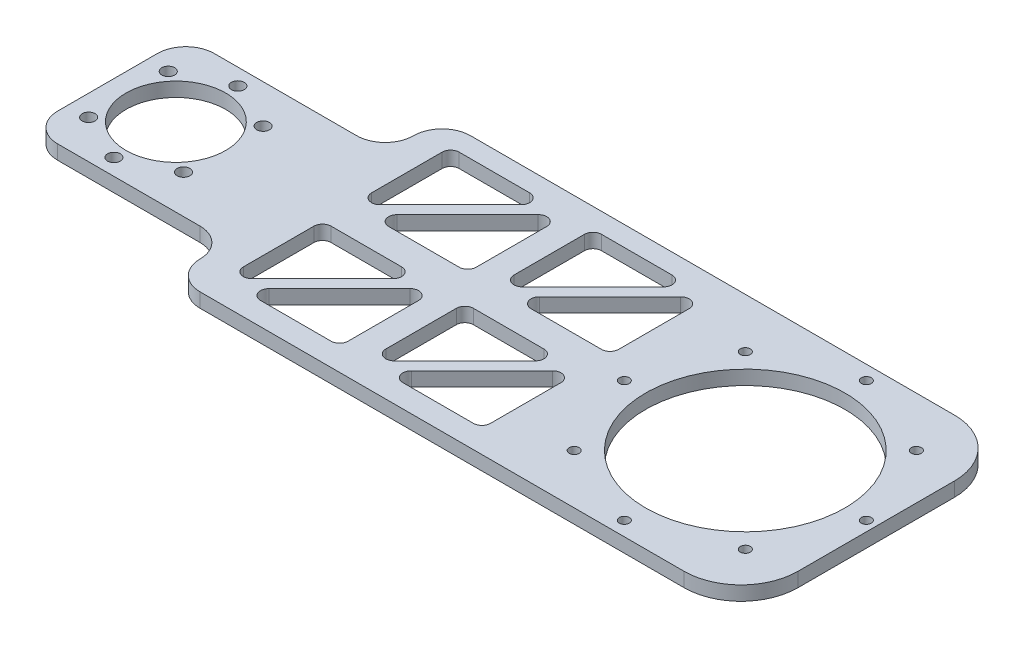
from build123d import *

# Parameters (mm, degrees)
SKETCH_1_W          = 270
SKETCH_1_H          = 5
EXTRUDE_1_DEPTH     = 95
SKETCH_2_R          = 2.25
SKETCH_2_R_2        = 1.75
SKETCH_2_R_3        = 17.5
SKETCH_2_R_4        = 35
CUT_EXTRUDE_1_DEPTH = 10
SKETCH_3_W          = 70
SKETCH_3_H          = 20
CUT_EXTRUDE_2_DEPTH = 10
FILLET_1_R          = 10
FILLET_2_R          = 20


with BuildPart() as part:
    # 草图1 → 拉伸-薄壁1 (new body)
    with BuildSketch(Plane.XY):
        with Locations((-135, -2.5)):
            Rectangle(SKETCH_1_W, SKETCH_1_H)
    extrude(amount=EXTRUDE_1_DEPTH)

    # 草图2 → 切除-拉伸1 (cut)
    with BuildSketch(Plane(origin=(0, 0, 0), x_dir=(1, 0, 0), z_dir=(0, 1, 0))):
        with Locations(Location((-246, -25.75, 0), (0, 0, 270))):
            Circle(SKETCH_2_R)
        with Locations(Location((-229.338533362, -33.519369489, 0), (0, 0, 270))):
            Circle(SKETCH_2_R)
        with Locations(Location((-262.661466638, -33.519369489, 0), (0, 0, 270))):
            Circle(SKETCH_2_R)
        with Locations(Location((-262.661466638, -61.480630511, 0), (0, 0, 270))):
            Circle(SKETCH_2_R)
        with Locations(Location((-246, -69.25, 0), (0, 0, 270))):
            Circle(SKETCH_2_R)
        with Locations(Location((-229.338533362, -61.480630511, 0), (0, 0, 270))):
            Circle(SKETCH_2_R)
        with Locations(Location((-3.5, -47.5, 0), (0, 0, 270))):
            Circle(SKETCH_2_R_2)
        with Locations(Location((-15.9479618, -77.5520382, 0), (0, 0, 270))):
            Circle(SKETCH_2_R_2)
        with Locations(Location((-46, -90, 0), (0, 0, 270))):
            Circle(SKETCH_2_R_2)
        with Locations(Location((-76.0520382, -77.5520382, 0), (0, 0, 270))):
            Circle(SKETCH_2_R_2)
        with Locations(Location((-88.5, -47.5, 0), (0, 0, 270))):
            Circle(SKETCH_2_R_2)
        with Locations(Location((-76.0520382, -17.4479618, 0), (0, 0, 270))):
            Circle(SKETCH_2_R_2)
        with Locations(Location((-46, -5, 0), (0, 0, 270))):
            Circle(SKETCH_2_R_2)
        with Locations(Location((-15.9479618, -17.4479618, 0), (0, 0, 270))):
            Circle(SKETCH_2_R_2)
        with Locations(Location((-246, -47.5, 0), (0, 0, 270))):
            Circle(SKETCH_2_R_3)
        with Locations(Location((-46, -47.5, 0), (0, 0, 270))):
            Circle(SKETCH_2_R_4)
    extrude(amount=-CUT_EXTRUDE_1_DEPTH, mode=Mode.SUBTRACT)

    # 草图3 → 切除-拉伸2 (cut)
    with BuildSketch(Plane(origin=(0, 0, 0), x_dir=(1, 0, 0), z_dir=(0, 1, 0))):
        with Locations((-235, -85)):
            Rectangle(SKETCH_3_W, SKETCH_3_H)
        with Locations((-235, -10)):
            Rectangle(SKETCH_3_W, SKETCH_3_H)
        with BuildLine():
            Line((-190, -10), (-190, -34.757359313))
            ThreePointArc((-190, -34.757359313), (-188.148050297, -37.52899791), (-184.878679656, -36.878679656))
            Line((-184.878679656, -36.878679656), (-160.121320344, -12.121320344))
            ThreePointArc((-160.121320344, -12.121320344), (-159.47100209, -8.851949703), (-162.242640687, -7))
            Line((-162.242640687, -7), (-187, -7))
            ThreePointArc((-187, -7), (-189.121320344, -7.878679656), (-190, -10))
        make_face()
        with BuildLine():
            Line((-154.121320344, -12.121320344), (-178.878679656, -36.878679656))
            ThreePointArc((-178.878679656, -36.878679656), (-179.52899791, -40.148050297), (-176.757359313, -42))
            Line((-176.757359313, -42), (-152, -42))
            ThreePointArc((-152, -42), (-149.878679656, -41.121320344), (-149, -39))
            Line((-149, -39), (-149, -14.242640687))
            ThreePointArc((-149, -14.242640687), (-150.851949703, -11.47100209), (-154.121320344, -12.121320344))
        make_face()
        with BuildLine():
            Line((-112.242640687, -7), (-137, -7))
            ThreePointArc((-137, -7), (-139.121320344, -7.878679656), (-140, -10))
            Line((-140, -10), (-140, -34.757359313))
            ThreePointArc((-140, -34.757359313), (-138.148050297, -37.52899791), (-134.878679656, -36.878679656))
            Line((-134.878679656, -36.878679656), (-110.121320344, -12.121320344))
            ThreePointArc((-110.121320344, -12.121320344), (-109.47100209, -8.851949703), (-112.242640687, -7))
        make_face()
        with BuildLine():
            Line((-99, -39), (-99, -14.242640687))
            ThreePointArc((-99, -14.242640687), (-100.851949703, -11.47100209), (-104.121320344, -12.121320344))
            Line((-104.121320344, -12.121320344), (-128.878679656, -36.878679656))
            ThreePointArc((-128.878679656, -36.878679656), (-129.52899791, -40.148050297), (-126.757359313, -42))
            Line((-126.757359313, -42), (-102, -42))
            ThreePointArc((-102, -42), (-99.878679656, -41.121320344), (-99, -39))
        make_face()
        with BuildLine():
            Line((-112.242640687, -52), (-137, -52))
            ThreePointArc((-137, -52), (-139.121320344, -52.878679656), (-140, -55))
            Line((-140, -55), (-140, -79.757359313))
            ThreePointArc((-140, -79.757359313), (-138.148050297, -82.52899791), (-134.878679656, -81.878679656))
            Line((-134.878679656, -81.878679656), (-110.121320344, -57.121320344))
            ThreePointArc((-110.121320344, -57.121320344), (-109.47100209, -53.851949703), (-112.242640687, -52))
        make_face()
        with BuildLine():
            Line((-99, -84), (-99, -59.242640687))
            ThreePointArc((-99, -59.242640687), (-100.851949703, -56.47100209), (-104.121320344, -57.121320344))
            Line((-104.121320344, -57.121320344), (-128.878679656, -81.878679656))
            ThreePointArc((-128.878679656, -81.878679656), (-129.52899791, -85.148050297), (-126.757359313, -87))
            Line((-126.757359313, -87), (-102, -87))
            ThreePointArc((-102, -87), (-99.878679656, -86.121320344), (-99, -84))
        make_face()
        with BuildLine():
            Line((-162.242640687, -52), (-187, -52))
            ThreePointArc((-187, -52), (-189.121320344, -52.878679656), (-190, -55))
            Line((-190, -55), (-190, -79.757359313))
            ThreePointArc((-190, -79.757359313), (-188.148050297, -82.52899791), (-184.878679656, -81.878679656))
            Line((-184.878679656, -81.878679656), (-160.121320344, -57.121320344))
            ThreePointArc((-160.121320344, -57.121320344), (-159.47100209, -53.851949703), (-162.242640687, -52))
        make_face()
        with BuildLine():
            Line((-149, -84), (-149, -59.242640687))
            ThreePointArc((-149, -59.242640687), (-150.851949703, -56.47100209), (-154.121320344, -57.121320344))
            Line((-154.121320344, -57.121320344), (-178.878679656, -81.878679656))
            ThreePointArc((-178.878679656, -81.878679656), (-179.52899791, -85.148050297), (-176.757359313, -87))
            Line((-176.757359313, -87), (-152, -87))
            ThreePointArc((-152, -87), (-149.878679656, -86.121320344), (-149, -84))
        make_face()
    extrude(amount=-CUT_EXTRUDE_2_DEPTH, mode=Mode.SUBTRACT)

    # 圆角1
    fillet_1_edges = [part.edges().sort_by_distance(p)[0] for p in [
        (-200, -2.5, 95),
        (-200, -2.5, 0),
        (-200, -2.5, 20),
        (-200, -2.5, 75),
        (-270, -2.5, 75),
        (-270, -2.5, 20),
    ]]
    fillet(fillet_1_edges, radius=FILLET_1_R - 0.0001)  # a hair under: the kernel refuses the full size

    # 圆角2
    fillet_2_edges = [part.edges().sort_by_distance(p)[0] for p in [
        (0, -2.5, 0),
        (0, -2.5, 95),
    ]]
    fillet(fillet_2_edges, radius=FILLET_2_R)


solid = part.part
